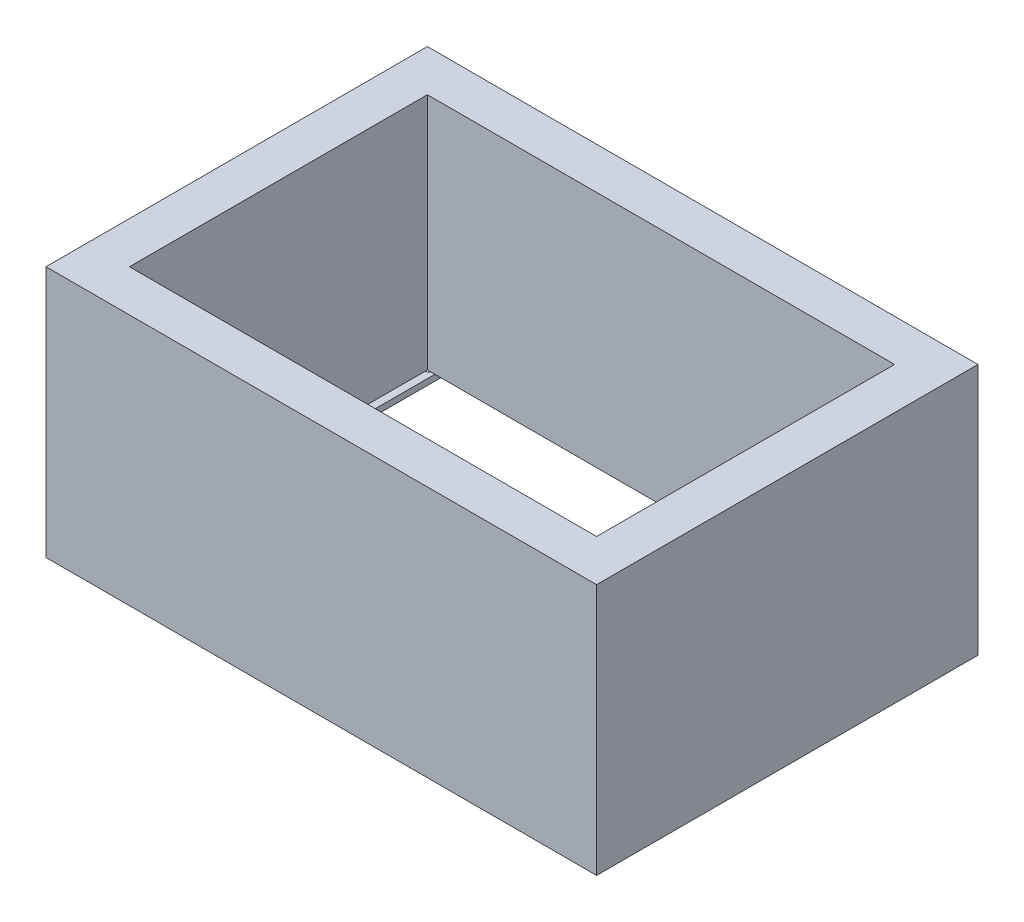
from build123d import *

# Parameters (mm, degrees)
SKETCH1_W               = 117.348
SKETCH1_H               = 81.28
SKETCH1_W_2             = 99.568
SKETCH1_H_2             = 63.5
BOSS_EXTRUDE1_DEPTH     = 50.8
BOSS_EXTRUDE2_DEPTH     = 1.600000102
BOSS_EXTRUDE3_DEPTH     = 1.27
CUT_EXTRUDE1_DEPTH      = 12.7
CUT_EXTRUDE1_DEPTH_BACK = 88.606437412
SKETCH1_5_R             = 1.524


with BuildPart() as part:
    # Sketch1 → Boss-Extrude1 (new body)
    with BuildSketch(Plane(origin=(0, 0, 0), x_dir=(1, 0, 0), z_dir=(0, 1, 0))):
        Rectangle(SKETCH1_W, SKETCH1_H)
        Rectangle(SKETCH1_W_2, SKETCH1_H_2, mode=Mode.SUBTRACT)
    extrude(amount=BOSS_EXTRUDE1_DEPTH)

    # Sketch1<6> → Boss-Extrude2 (add)
    with BuildSketch(Plane(origin=(0, 0, 0), x_dir=(1, 0, 0), z_dir=(0, 1, 0))):
        Polygon((56.134, -38.1), (-56.134, -38.1), (-56.134, 38.1), (-56.134, 40.64), (-58.674, 40.64), (-58.674, -40.64), (58.674, -40.64), (58.674, 40.64), (56.134, 40.64), (56.134, 38.1), align=None)
    extrude(amount=-BOSS_EXTRUDE2_DEPTH)

    # Sketch2 → Boss-Extrude3 (add)
    with BuildSketch(Plane.XZ.offset(1.600000102)):
        Polygon((58.674, 40.64), (-58.674, 40.64), (-58.674, -40.64), (-49.784, -40.64), (-49.784, 34.29), (49.784, 34.29), (49.784, -40.64), (58.674, -40.64), align=None)
    extrude(amount=BOSS_EXTRUDE3_DEPTH)

    # Sketch1<5> → Cut-Extrude1 (cut, two sides: drawn at the far end of the back side and taken through both)
    with BuildSketch(Plane(origin=(0, 0, 0), x_dir=(1, 0, 0), z_dir=(0, 1, 0)).offset(-CUT_EXTRUDE1_DEPTH_BACK)):
        with Locations((-51.816, 34.29)):
            Circle(SKETCH1_5_R)
        with Locations((52.324, 34.29)):
            Circle(SKETCH1_5_R)
        with Locations((52.324, -34.29)):
            Circle(SKETCH1_5_R)
        with Locations((-51.816, -34.29)):
            Circle(SKETCH1_5_R)
    extrude(amount=CUT_EXTRUDE1_DEPTH + CUT_EXTRUDE1_DEPTH_BACK, mode=Mode.SUBTRACT)


solid = part.part
